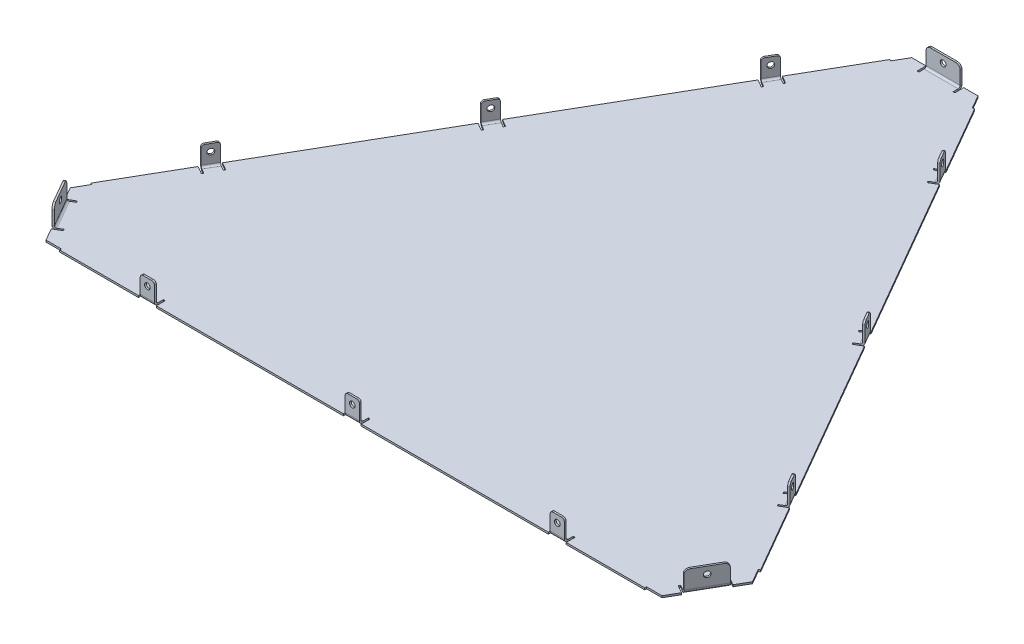
from build123d import *

# Parameters (mm, degrees)
BOSS_EXTRUDE1_DEPTH            = 1
EDGE_FLANGE1_STRIP_W           = 6.2
EDGE_FLANGE1_STRIP_H           = 1
EDGE_FLANGE1_STRIP_CUT_DEPTH   = 19.17
EDGE_FLANGE1_STRIP_2_W         = 6.2
EDGE_FLANGE1_STRIP_2_H         = 1
EDGE_FLANGE1_STRIP_CUT_2_DEPTH = 19.13
EDGE_FLANGE1_STRIP_3_W         = 6.2
EDGE_FLANGE1_STRIP_3_H         = 1
EDGE_FLANGE1_STRIP_CUT_3_DEPTH = 19.13
EDGE_FLANGE1_DEPTH             = 19.17
EDGE_FLANGE1_BEND_DEPTH        = 19.13
EDGE_FLANGE1_BEND_2_DEPTH      = 19.13
FILLET1_R                      = 2.5
EDGE_FLANGE2_STRIP_W           = 6.2
EDGE_FLANGE2_STRIP_H           = 1
EDGE_FLANGE2_STRIP_CUT_DEPTH   = 8
EDGE_FLANGE2_STRIP_2_W         = 6.2
EDGE_FLANGE2_STRIP_2_H         = 1
EDGE_FLANGE2_STRIP_CUT_2_DEPTH = 8
EDGE_FLANGE2_STRIP_3_W         = 6.2
EDGE_FLANGE2_STRIP_3_H         = 1
EDGE_FLANGE2_STRIP_CUT_3_DEPTH = 8
EDGE_FLANGE2_STRIP_4_W         = 6.2
EDGE_FLANGE2_STRIP_4_H         = 1
EDGE_FLANGE2_STRIP_CUT_4_DEPTH = 8
EDGE_FLANGE2_STRIP_5_W         = 6.2
EDGE_FLANGE2_STRIP_5_H         = 1
EDGE_FLANGE2_STRIP_CUT_5_DEPTH = 8
EDGE_FLANGE2_STRIP_6_W         = 6.2
EDGE_FLANGE2_STRIP_6_H         = 1
EDGE_FLANGE2_STRIP_CUT_6_DEPTH = 8
EDGE_FLANGE2_STRIP_7_W         = 6.2
EDGE_FLANGE2_STRIP_7_H         = 1
EDGE_FLANGE2_STRIP_CUT_7_DEPTH = 8
EDGE_FLANGE2_STRIP_8_W         = 6.2
EDGE_FLANGE2_STRIP_8_H         = 1
EDGE_FLANGE2_STRIP_CUT_8_DEPTH = 8
EDGE_FLANGE2_STRIP_9_W         = 6.2
EDGE_FLANGE2_STRIP_9_H         = 1
EDGE_FLANGE2_STRIP_CUT_9_DEPTH = 8
EDGE_FLANGE2_DEPTH             = 8
EDGE_FLANGE2_BEND_DEPTH        = 8
EDGE_FLANGE2_BEND_2_DEPTH      = 8
EDGE_FLANGE2_BEND_3_DEPTH      = 8
EDGE_FLANGE2_BEND_4_DEPTH      = 8
EDGE_FLANGE2_BEND_5_DEPTH      = 8
EDGE_FLANGE2_BEND_6_DEPTH      = 8
EDGE_FLANGE2_BEND_7_DEPTH      = 8
EDGE_FLANGE2_BEND_8_DEPTH      = 8
FILLET2_R                      = 1.5
SKETCH42_R                     = 1.6
CUT_EXTRUDE1_DEPTH             = 1
SKETCH43_R                     = 1.6
CUT_EXTRUDE2_DEPTH             = 1
SKETCH44_R                     = 1.6
CUT_EXTRUDE3_DEPTH             = 1
SKETCH45_R                     = 1.6
CUT_EXTRUDE4_DEPTH             = 10
SKETCH46_R                     = 1.6
CUT_EXTRUDE5_DEPTH             = 10
SKETCH47_R                     = 1.6
CUT_EXTRUDE6_DEPTH             = 10


# Sheet-metal steps are written as plain solids
with BuildPart() as part:
    # Sketch1 → Boss-Extrude1 (new body)
    with BuildSketch(Plane(origin=(0, 0, 0), x_dir=(1, 0, 0), z_dir=(0, 1, 0))):
        Polygon((-2.259810517, 187.062411747), (2.090189483, 194.59683276), (10.090189483, 194.59683276), (10.090189483, 189.59683276), (11.090189483, 189.59683276), (11.090189483, 194.59683276), (30.260189483, 194.59683276), (30.260189483, 189.59683276), (31.260189483, 189.59683276), (31.260189483, 194.59683276), (39.26057424, 194.59683276), (43.61057424, 187.062411747), (44.469773433, 187.558470632), (66.511269353, 149.381479823), (62.181142334, 146.881479823), (62.681142334, 146.01545442), (67.011269353, 148.51545442), (71.011269353, 141.587251189), (66.681142334, 139.087251189), (67.181142334, 138.221225786), (71.511269353, 140.721225786), (124.011269353, 49.788558388), (119.681142334, 47.288558388), (120.181142334, 46.422532984), (124.511269353, 48.922532984), (128.511269353, 41.994329754), (124.181142334, 39.494329754), (124.681142334, 38.62830435), (129.011269353, 41.12830435), (181.511269353, -49.804363047), (177.181142334, -52.304363047), (177.681142334, -53.170388451), (182.011269353, -50.670388451), (186.011269353, -57.598591681), (181.681142334, -60.098591681), (182.181142334, -60.964617085), (186.511269353, -58.464617085), (208.601269353, -96.725619424), (207.735243949, -97.225619424), (212.085243949, -104.760040437), (208.06505157, -111.723217893), (203.734924551, -109.223217893), (203.234924551, -110.089243297), (207.56505157, -112.589243297), (198.00005157, -129.156309272), (193.669924551, -126.656309272), (193.169924551, -127.522334675), (197.50005157, -130.022334675), (193.50005157, -136.950537906), (184.80005157, -136.950537906), (184.80005157, -137.950537906), (140.721610537, -137.950537906), (140.721610537, -132.952033259), (139.721610537, -132.952033259), (139.721610537, -137.950537906), (131.721610537, -137.950537906), (131.721610537, -132.952033259), (130.721610537, -132.952033259), (130.721610537, -137.950537906), (25.721610537, -137.950537906), (25.721610537, -132.952033259), (24.721610537, -132.952033259), (24.721610537, -137.950537906), (16.721610537, -137.950537906), (16.721610537, -132.952033259), (15.721610537, -132.952033259), (15.721610537, -137.950537906), (-89.278389463, -137.950537906), (-89.278389463, -132.952033259), (-90.278389463, -132.952033259), (-90.278389463, -137.950537906), (-98.278389463, -137.950537906), (-98.278389463, -132.952033259), (-99.278389463, -132.952033259), (-99.278389463, -137.950537906), (-143.458389463, -137.950537906), (-143.458389463, -136.950537906), (-152.158389463, -136.950537906), (-156.158389463, -130.022334675), (-151.828262444, -127.522334675), (-152.328262444, -126.656309272), (-156.658389463, -129.156309272), (-166.223389463, -112.589243297), (-161.893262444, -110.089243297), (-162.393262444, -109.223217893), (-166.723389463, -111.723217893), (-170.743581841, -104.760040437), (-166.393581841, -97.225619424), (-167.259607245, -96.725619424), (-145.215835921, -58.5446875), (-140.885708902, -61.0446875), (-140.385708902, -60.178662097), (-144.715835921, -57.678662097), (-140.715835921, -50.750458866), (-136.385708902, -53.250458866), (-135.885708902, -52.384433463), (-140.215835921, -49.884433463), (-87.715835921, 41.048233935), (-83.385708902, 38.548233935), (-82.885708902, 39.414259339), (-87.215835921, 41.914259339), (-83.215835921, 48.842462569), (-78.885708902, 46.342462569), (-78.385708902, 47.208487973), (-82.715835921, 49.708487973), (-30.215835921, 140.64115537), (-25.885708902, 138.14115537), (-25.385708902, 139.007180774), (-29.715835921, 141.507180774), (-25.715835921, 148.435384004), (-21.385708902, 145.935384004), (-20.885708902, 146.801409408), (-25.215835921, 149.301409408), (-3.125835921, 187.562411747), align=None)
    extrude(amount=BOSS_EXTRUDE1_DEPTH)

    # Edge-Flange1 strip (across the edge) → Edge-Flange1 strip cut (cut)
    with BuildSketch(Plane(origin=(30.260189483, 1, -194.59683276), x_dir=(0, 0, 1), z_dir=(-1, 0, 0))):
        with Locations((-1, -0.5)):
            Rectangle(EDGE_FLANGE1_STRIP_W, EDGE_FLANGE1_STRIP_H)
    extrude(amount=EDGE_FLANGE1_STRIP_CUT_DEPTH, mode=Mode.SUBTRACT)

    # Edge-Flange1 strip 2 (across the edge) → Edge-Flange1 strip cut 2 (cut)
    with BuildSketch(Plane(origin=(198.00005157, 1, 129.156309272), x_dir=(-0.866025403784439, 3.491481338843133e-15, -0.4999999999999995), z_dir=(0.4999999999999995, 0, -0.866025403784439))):
        with Locations((-1, -0.5)):
            Rectangle(EDGE_FLANGE1_STRIP_2_W, EDGE_FLANGE1_STRIP_2_H)
    extrude(amount=EDGE_FLANGE1_STRIP_CUT_2_DEPTH, mode=Mode.SUBTRACT)

    # Edge-Flange1 strip 3 (across the edge) → Edge-Flange1 strip cut 3 (cut)
    with BuildSketch(Plane(origin=(-166.223389463, 1, 112.589243297), x_dir=(0.8660254037844379, 3.4914813388431334e-15, -0.5000000000000012), z_dir=(0.5000000000000012, 0, 0.8660254037844379))):
        with Locations((-1, -0.5)):
            Rectangle(EDGE_FLANGE1_STRIP_3_W, EDGE_FLANGE1_STRIP_3_H)
    extrude(amount=EDGE_FLANGE1_STRIP_CUT_3_DEPTH, mode=Mode.SUBTRACT)

    # Edge-Flange1 section (across the edge) → Edge-Flange1 (add)
    with BuildSketch(Plane(origin=(30.260189483, 1, -194.59683276), x_dir=(0, 0, 1), z_dir=(-1, 0, 0))):
        with BuildLine():
            Line((0, 1.1), (0, 11))
            Line((0, 11), (1, 11))
            Line((1, 11), (1, 1.1))
            ThreePointArc((1, 1.1), (1.322182541, 0.322182541), (2.1, 0))
            Line((2.1, 0), (2.1, -1))
            ThreePointArc((2.1, -1), (0.61507576, -0.38492424), (0, 1.1))
        make_face()
    extrude(amount=EDGE_FLANGE1_DEPTH)

    # Edge-Flange1 section 2 (across the edge) → Edge-Flange1 bend (add)
    with BuildSketch(Plane(origin=(198.00005157, 1, 129.156309272), x_dir=(-0.866025403784439, 3.491481338843133e-15, -0.4999999999999995), z_dir=(0.4999999999999995, 0, -0.866025403784439))):
        with BuildLine():
            Line((0, 1.1), (0, 11))
            Line((0, 11), (1, 11))
            Line((1, 11), (1, 1.1))
            ThreePointArc((1, 1.1), (1.322182541, 0.322182541), (2.1, 0))
            Line((2.1, 0), (2.1, -1))
            ThreePointArc((2.1, -1), (0.61507576, -0.38492424), (0, 1.1))
        make_face()
    extrude(amount=EDGE_FLANGE1_BEND_DEPTH)

    # Edge-Flange1 section 3 (across the edge) → Edge-Flange1 bend 2 (add)
    with BuildSketch(Plane(origin=(-166.223389463, 1, 112.589243297), x_dir=(0.8660254037844379, 3.4914813388431334e-15, -0.5000000000000012), z_dir=(0.5000000000000012, 0, 0.8660254037844379))):
        with BuildLine():
            Line((0, 1.1), (0, 11))
            Line((0, 11), (1, 11))
            Line((1, 11), (1, 1.1))
            ThreePointArc((1, 1.1), (1.322182541, 0.322182541), (2.1, 0))
            Line((2.1, 0), (2.1, -1))
            ThreePointArc((2.1, -1), (0.61507576, -0.38492424), (0, 1.1))
        make_face()
    extrude(amount=EDGE_FLANGE1_BEND_2_DEPTH)

    # Fillet1
    fillet1_edges = [part.edges().sort_by_distance(p)[0] for p in [
        (30.260189483, 12, -194.09683276),
        (11.090189483, 12, -194.09683276),
        (197.567038868, 12, 128.906309272),
        (207.132038868, 12, 112.339243297),
        (-165.790376761, 12, 112.339243297),
        (-156.225376761, 12, 128.906309272),
    ]]
    fillet(fillet1_edges, radius=FILLET1_R)

    # Edge-Flange2 strip (across the edge) → Edge-Flange2 strip cut (cut)
    with BuildSketch(Plane(origin=(-98.278389463, 1, 137.950537906), x_dir=(0, 0, -1), z_dir=(1, 0, 0))):
        with Locations((-1, -0.5)):
            Rectangle(EDGE_FLANGE2_STRIP_W, EDGE_FLANGE2_STRIP_H)
    extrude(amount=EDGE_FLANGE2_STRIP_CUT_DEPTH, mode=Mode.SUBTRACT)

    # Edge-Flange2 strip 2 (across the edge) → Edge-Flange2 strip cut 2 (cut)
    with BuildSketch(Plane(origin=(16.721610537, 1, 137.950537906), x_dir=(0, 0, -1), z_dir=(1, 0, 0))):
        with Locations((-1, -0.5)):
            Rectangle(EDGE_FLANGE2_STRIP_2_W, EDGE_FLANGE2_STRIP_2_H)
    extrude(amount=EDGE_FLANGE2_STRIP_CUT_2_DEPTH, mode=Mode.SUBTRACT)

    # Edge-Flange2 strip 3 (across the edge) → Edge-Flange2 strip cut 3 (cut)
    with BuildSketch(Plane(origin=(131.721610537, 1, 137.950537906), x_dir=(0, 0, -1), z_dir=(1, 0, 0))):
        with Locations((-1, -0.5)):
            Rectangle(EDGE_FLANGE2_STRIP_3_W, EDGE_FLANGE2_STRIP_3_H)
    extrude(amount=EDGE_FLANGE2_STRIP_CUT_3_DEPTH, mode=Mode.SUBTRACT)

    # Edge-Flange2 strip 4 (across the edge) → Edge-Flange2 strip cut 4 (cut)
    with BuildSketch(Plane(origin=(186.011269353, 1, 57.598591681), x_dir=(-0.8660254037844403, 3.4914813388431334e-15, 0.4999999999999975), z_dir=(-0.4999999999999975, 0, -0.8660254037844403))):
        with Locations((-1, -0.5)):
            Rectangle(EDGE_FLANGE2_STRIP_4_W, EDGE_FLANGE2_STRIP_4_H)
    extrude(amount=EDGE_FLANGE2_STRIP_CUT_4_DEPTH, mode=Mode.SUBTRACT)

    # Edge-Flange2 strip 5 (across the edge) → Edge-Flange2 strip cut 5 (cut)
    with BuildSketch(Plane(origin=(128.511269353, 1, -41.994329754), x_dir=(-0.8660254037844394, 3.5155183724229278e-15, 0.4999999999999987), z_dir=(-0.4999999999999987, 0, -0.8660254037844394))):
        with Locations((-1, -0.5)):
            Rectangle(EDGE_FLANGE2_STRIP_5_W, EDGE_FLANGE2_STRIP_5_H)
    extrude(amount=EDGE_FLANGE2_STRIP_CUT_5_DEPTH, mode=Mode.SUBTRACT)

    # Edge-Flange2 strip 6 (across the edge) → Edge-Flange2 strip cut 6 (cut)
    with BuildSketch(Plane(origin=(71.011269353, 1, -141.587251189), x_dir=(-0.8660254037844404, 3.4914813388431334e-15, 0.4999999999999973), z_dir=(-0.4999999999999973, 0, -0.8660254037844404))):
        with Locations((-1, -0.5)):
            Rectangle(EDGE_FLANGE2_STRIP_6_W, EDGE_FLANGE2_STRIP_6_H)
    extrude(amount=EDGE_FLANGE2_STRIP_CUT_6_DEPTH, mode=Mode.SUBTRACT)

    # Edge-Flange2 strip 7 (across the edge) → Edge-Flange2 strip cut 7 (cut)
    with BuildSketch(Plane(origin=(-25.715835921, 1, -148.435384004), x_dir=(0.8660254037844387, 3.491481338843133e-15, 0.5000000000000001), z_dir=(-0.5000000000000001, 0, 0.8660254037844387))):
        with Locations((-1, -0.5)):
            Rectangle(EDGE_FLANGE2_STRIP_7_W, EDGE_FLANGE2_STRIP_7_H)
    extrude(amount=EDGE_FLANGE2_STRIP_CUT_7_DEPTH, mode=Mode.SUBTRACT)

    # Edge-Flange2 strip 8 (across the edge) → Edge-Flange2 strip cut 8 (cut)
    with BuildSketch(Plane(origin=(-83.215835921, 1, -48.842462569), x_dir=(0.8660254037844392, 3.4914813388431334e-15, 0.4999999999999991), z_dir=(-0.4999999999999991, 0, 0.8660254037844392))):
        with Locations((-1, -0.5)):
            Rectangle(EDGE_FLANGE2_STRIP_8_W, EDGE_FLANGE2_STRIP_8_H)
    extrude(amount=EDGE_FLANGE2_STRIP_CUT_8_DEPTH, mode=Mode.SUBTRACT)

    # Edge-Flange2 strip 9 (across the edge) → Edge-Flange2 strip cut 9 (cut)
    with BuildSketch(Plane(origin=(-140.715835921, 1, 50.750458866), x_dir=(0.8660254037844387, 3.4914813388431334e-15, 0.5000000000000001), z_dir=(-0.5000000000000001, 0, 0.8660254037844387))):
        with Locations((-1, -0.5)):
            Rectangle(EDGE_FLANGE2_STRIP_9_W, EDGE_FLANGE2_STRIP_9_H)
    extrude(amount=EDGE_FLANGE2_STRIP_CUT_9_DEPTH, mode=Mode.SUBTRACT)

    # Edge-Flange2 section (across the edge) → Edge-Flange2 (add)
    with BuildSketch(Plane(origin=(-98.278389463, 1, 137.950537906), x_dir=(0, 0, -1), z_dir=(1, 0, 0))):
        with BuildLine():
            Line((0, 1.1), (0, 11))
            Line((0, 11), (1, 11))
            Line((1, 11), (1, 1.1))
            ThreePointArc((1, 1.1), (1.322182541, 0.322182541), (2.1, 0))
            Line((2.1, 0), (2.1, -1))
            ThreePointArc((2.1, -1), (0.61507576, -0.38492424), (0, 1.1))
        make_face()
    extrude(amount=EDGE_FLANGE2_DEPTH)

    # Edge-Flange2 section 2 (across the edge) → Edge-Flange2 bend (add)
    with BuildSketch(Plane(origin=(16.721610537, 1, 137.950537906), x_dir=(0, 0, -1), z_dir=(1, 0, 0))):
        with BuildLine():
            Line((0, 1.1), (0, 11))
            Line((0, 11), (1, 11))
            Line((1, 11), (1, 1.1))
            ThreePointArc((1, 1.1), (1.322182541, 0.322182541), (2.1, 0))
            Line((2.1, 0), (2.1, -1))
            ThreePointArc((2.1, -1), (0.61507576, -0.38492424), (0, 1.1))
        make_face()
    extrude(amount=EDGE_FLANGE2_BEND_DEPTH)

    # Edge-Flange2 section 3 (across the edge) → Edge-Flange2 bend 2 (add)
    with BuildSketch(Plane(origin=(131.721610537, 1, 137.950537906), x_dir=(0, 0, -1), z_dir=(1, 0, 0))):
        with BuildLine():
            Line((0, 1.1), (0, 11))
            Line((0, 11), (1, 11))
            Line((1, 11), (1, 1.1))
            ThreePointArc((1, 1.1), (1.322182541, 0.322182541), (2.1, 0))
            Line((2.1, 0), (2.1, -1))
            ThreePointArc((2.1, -1), (0.61507576, -0.38492424), (0, 1.1))
        make_face()
    extrude(amount=EDGE_FLANGE2_BEND_2_DEPTH)

    # Edge-Flange2 section 4 (across the edge) → Edge-Flange2 bend 3 (add)
    with BuildSketch(Plane(origin=(186.011269353, 1, 57.598591681), x_dir=(-0.8660254037844403, 3.4914813388431334e-15, 0.4999999999999975), z_dir=(-0.4999999999999975, 0, -0.8660254037844403))):
        with BuildLine():
            Line((0, 1.1), (0, 11))
            Line((0, 11), (1, 11))
            Line((1, 11), (1, 1.1))
            ThreePointArc((1, 1.1), (1.322182541, 0.322182541), (2.1, 0))
            Line((2.1, 0), (2.1, -1))
            ThreePointArc((2.1, -1), (0.61507576, -0.38492424), (0, 1.1))
        make_face()
    extrude(amount=EDGE_FLANGE2_BEND_3_DEPTH)

    # Edge-Flange2 section 5 (across the edge) → Edge-Flange2 bend 4 (add)
    with BuildSketch(Plane(origin=(128.511269353, 1, -41.994329754), x_dir=(-0.8660254037844394, 3.5155183724229278e-15, 0.4999999999999987), z_dir=(-0.4999999999999987, 0, -0.8660254037844394))):
        with BuildLine():
            Line((0, 1.1), (0, 11))
            Line((0, 11), (1, 11))
            Line((1, 11), (1, 1.1))
            ThreePointArc((1, 1.1), (1.322182541, 0.322182541), (2.1, 0))
            Line((2.1, 0), (2.1, -1))
            ThreePointArc((2.1, -1), (0.61507576, -0.38492424), (0, 1.1))
        make_face()
    extrude(amount=EDGE_FLANGE2_BEND_4_DEPTH)

    # Edge-Flange2 section 6 (across the edge) → Edge-Flange2 bend 5 (add)
    with BuildSketch(Plane(origin=(71.011269353, 1, -141.587251189), x_dir=(-0.8660254037844404, 3.4914813388431334e-15, 0.4999999999999973), z_dir=(-0.4999999999999973, 0, -0.8660254037844404))):
        with BuildLine():
            Line((0, 1.1), (0, 11))
            Line((0, 11), (1, 11))
            Line((1, 11), (1, 1.1))
            ThreePointArc((1, 1.1), (1.322182541, 0.322182541), (2.1, 0))
            Line((2.1, 0), (2.1, -1))
            ThreePointArc((2.1, -1), (0.61507576, -0.38492424), (0, 1.1))
        make_face()
    extrude(amount=EDGE_FLANGE2_BEND_5_DEPTH)

    # Edge-Flange2 section 7 (across the edge) → Edge-Flange2 bend 6 (add)
    with BuildSketch(Plane(origin=(-25.715835921, 1, -148.435384004), x_dir=(0.8660254037844387, 3.491481338843133e-15, 0.5000000000000001), z_dir=(-0.5000000000000001, 0, 0.8660254037844387))):
        with BuildLine():
            Line((0, 1.1), (0, 11))
            Line((0, 11), (1, 11))
            Line((1, 11), (1, 1.1))
            ThreePointArc((1, 1.1), (1.322182541, 0.322182541), (2.1, 0))
            Line((2.1, 0), (2.1, -1))
            ThreePointArc((2.1, -1), (0.61507576, -0.38492424), (0, 1.1))
        make_face()
    extrude(amount=EDGE_FLANGE2_BEND_6_DEPTH)

    # Edge-Flange2 section 8 (across the edge) → Edge-Flange2 bend 7 (add)
    with BuildSketch(Plane(origin=(-83.215835921, 1, -48.842462569), x_dir=(0.8660254037844392, 3.4914813388431334e-15, 0.4999999999999991), z_dir=(-0.4999999999999991, 0, 0.8660254037844392))):
        with BuildLine():
            Line((0, 1.1), (0, 11))
            Line((0, 11), (1, 11))
            Line((1, 11), (1, 1.1))
            ThreePointArc((1, 1.1), (1.322182541, 0.322182541), (2.1, 0))
            Line((2.1, 0), (2.1, -1))
            ThreePointArc((2.1, -1), (0.61507576, -0.38492424), (0, 1.1))
        make_face()
    extrude(amount=EDGE_FLANGE2_BEND_7_DEPTH)

    # Edge-Flange2 section 9 (across the edge) → Edge-Flange2 bend 8 (add)
    with BuildSketch(Plane(origin=(-140.715835921, 1, 50.750458866), x_dir=(0.8660254037844387, 3.4914813388431334e-15, 0.5000000000000001), z_dir=(-0.5000000000000001, 0, 0.8660254037844387))):
        with BuildLine():
            Line((0, 1.1), (0, 11))
            Line((0, 11), (1, 11))
            Line((1, 11), (1, 1.1))
            ThreePointArc((1, 1.1), (1.322182541, 0.322182541), (2.1, 0))
            Line((2.1, 0), (2.1, -1))
            ThreePointArc((2.1, -1), (0.61507576, -0.38492424), (0, 1.1))
        make_face()
    extrude(amount=EDGE_FLANGE2_BEND_8_DEPTH)

    # Fillet2
    fillet2_edges = [part.edges().sort_by_distance(p)[0] for p in [
        (-98.278389463, 12, 137.450537906),
        (-90.278389463, 12, 137.450537906),
        (16.721610537, 12, 137.450537906),
        (24.721610537, 12, 137.450537906),
        (131.721610537, 12, 137.450537906),
        (139.721610537, 12, 137.450537906),
        (185.578256651, 12, 57.848591681),
        (181.578256651, 12, 50.920388451),
        (128.078256651, 12, -41.744329754),
        (124.078256651, 12, -48.672532984),
        (70.578256651, 12, -141.337251189),
        (66.578256651, 12, -148.26545442),
        (-25.282823219, 12, -148.185384004),
        (-29.282823219, 12, -141.257180774),
        (-82.782823219, 12, -48.592462569),
        (-86.782823219, 12, -41.664259339),
        (-140.282823219, 12, 51.000458866),
        (-144.282823219, 12, 57.928662097),
    ]]
    fillet(fillet2_edges, radius=FILLET2_R)

    # Sketch42 → Cut-Extrude1 (cut)
    with BuildSketch(Plane(origin=(-83.561283625, 0, -48.244129595), x_dir=(-0.4999999999999998, -2.2078298785159348e-15, 0.8660254037844388), z_dir=(-0.8660254037844388, -3.824073524058226e-15, -0.4999999999999998))):
        with Locations((-111.690895407, 8)):
            Circle(SKETCH42_R)
        with Locations((3.309104593, 8)):
            Circle(SKETCH42_R)
        with Locations((118.309104593, 8)):
            Circle(SKETCH42_R)
    extrude(amount=-CUT_EXTRUDE1_DEPTH, mode=Mode.SUBTRACT)

    # Sketch43 → Cut-Extrude2 (cut)
    with BuildSketch(Plane.XY.offset(137.950537906)):
        with Locations((-94.278389463, 8)):
            Circle(SKETCH43_R)
        with Locations((20.721610537, 8)):
            Circle(SKETCH43_R)
        with Locations((135.721610537, 8)):
            Circle(SKETCH43_R)
    extrude(amount=-CUT_EXTRUDE2_DEPTH, mode=Mode.SUBTRACT)

    # Sketch44 → Cut-Extrude3 (cut)
    with BuildSketch(Plane(origin=(114.567530206, 0, -66.145594405), x_dir=(-0.4999999999999941, 0, -0.866025403784442), z_dir=(0.8660254037844421, 0, -0.49999999999999417))):
        with Locations((-138.887478295, 8)):
            Circle(SKETCH44_R)
        with Locations((-23.887478295, 8)):
            Circle(SKETCH44_R)
        with Locations((91.112521705, 8)):
            Circle(SKETCH44_R)
    extrude(amount=-CUT_EXTRUDE3_DEPTH, mode=Mode.SUBTRACT)

    # Sketch45 → Cut-Extrude4 (cut)
    with BuildSketch(Plane(origin=(204.426361122, 0, 118.025614623), x_dir=(0.5000000000000004, -1.2616170734376786e-15, -0.8660254037844384), z_dir=(0.8660254037844384, -2.1851848708904134e-15, 0.5000000000000004))):
        with Locations((-3.287619103, 8)):
            Circle(SKETCH45_R)
    extrude(amount=-CUT_EXTRUDE4_DEPTH, mode=Mode.SUBTRACT)

    # Sketch46 → Cut-Extrude5 (cut)
    with BuildSketch(Plane(origin=(0, 0, -194.59683276), x_dir=(-1, 0, 0), z_dir=(0, 0, -1))):
        with Locations(Location((-20.675189483, 8, 0), (0, 0, 90))):
            Circle(SKETCH46_R)
    extrude(amount=-CUT_EXTRUDE5_DEPTH, mode=Mode.SUBTRACT)

    # Sketch47 → Cut-Extrude6 (cut)
    with BuildSketch(Plane(origin=(-173.420114541, 0, 100.124149813), x_dir=(0.5000000000000012, 1.990012030401156e-15, 0.866025403784438), z_dir=(-0.866025403784438, -3.4468019443280924e-15, 0.5000000000000012))):
        with Locations((23.958450157, 8)):
            Circle(SKETCH47_R)
    extrude(amount=-CUT_EXTRUDE6_DEPTH, mode=Mode.SUBTRACT)


solid = part.part
